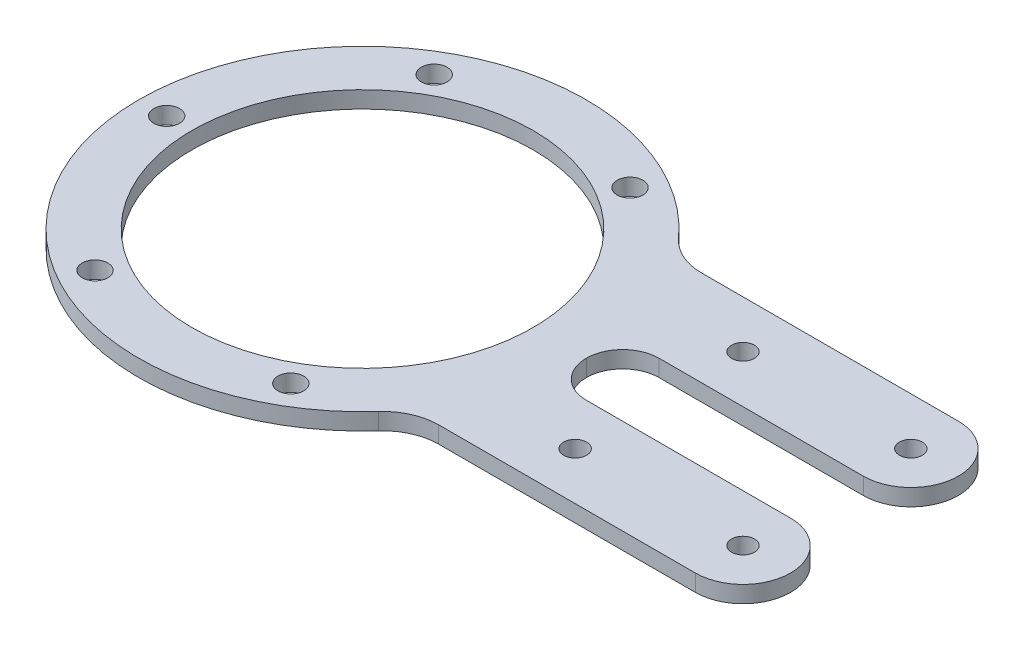
from build123d import *

# Parameters (mm, degrees)
SKETCH1_R           = 40
SKETCH1_R_2         = 30.5
BOSS_EXTRUDE1_DEPTH = 3
BOSS_EXTRUDE2_START = -3
BOSS_EXTRUDE2_DEPTH = 3
SKETCH3_R           = 2.05
CUT_EXTRUDE1_DEPTH  = 108.745069493
SKETCH4_R           = 2.3
CUT_EXTRUDE2_DEPTH  = 108.745069493
CUT_EXTRUDE3_DEPTH  = 108.745069493
FILLET1_R           = 10
FILLET2_R           = 6.5


with BuildPart() as part:
    # Sketch1 → Boss-Extrude1 (new body)
    with BuildSketch(Plane(origin=(0, 0, 0), x_dir=(1, 0, 0), z_dir=(0, 1, 0))):
        with Locations(Location((0, 0, 0), (0, 0, 270))):
            Circle(SKETCH1_R)
        with Locations(Location((0, 0, 0), (0, 0, 270))):
            Circle(SKETCH1_R_2, mode=Mode.SUBTRACT)
    extrude(amount=BOSS_EXTRUDE1_DEPTH)

    # Sketch2 → Boss-Extrude2 (add)
    with BuildSketch(Plane(origin=(0, 3, 0), x_dir=(1, 0, 0), z_dir=(0, 1, 0)).offset(BOSS_EXTRUDE2_START)):
        with BuildLine():
            Line((100, 6.5), (39.468341744, 6.5))
            ThreePointArc((39.468341744, 6.5), (36.910699238, 15.414288235), (32.368966619, 23.5))
            Line((32.368966619, 23.5), (100, 23.5))
            Line((100, 23.5), (100, 6.5))
        make_face()
        with BuildLine():
            Line((39.468341744, -6.5), (100, -6.5))
            Line((100, -6.5), (100, -23.5))
            Line((100, -23.5), (32.368966619, -23.5))
            ThreePointArc((32.368966619, -23.5), (36.910699238, -15.414288235), (39.468341744, -6.5))
        make_face()
    extrude(amount=BOSS_EXTRUDE2_DEPTH)

    # Sketch3 → Cut-Extrude1 (cut, through all)
    with BuildSketch(Plane(origin=(0, 3, 0), x_dir=(1, 0, 0), z_dir=(0, 1, 0))):
        with Locations(Location((53, 15, 0), (0, 0, 270))):
            Circle(SKETCH3_R)
        with Locations(Location((83, 15, 0), (0, 0, 270))):
            Circle(SKETCH3_R)
        with Locations(Location((53, -15, 0), (0, 0, 270))):
            Circle(SKETCH3_R)
        with Locations(Location((83, -15, 0), (0, 0, 270))):
            Circle(SKETCH3_R)
    extrude(amount=-CUT_EXTRUDE1_DEPTH, mode=Mode.SUBTRACT)

    # Sketch4 → Cut-Extrude2 (cut, through all)
    with BuildSketch(Plane(origin=(0, 3, 0), x_dir=(1, 0, 0), z_dir=(0, 1, 0))):
        with Locations(Location((-17.5, 30.310889132, 0), (0, 0, 270))):
            Circle(SKETCH4_R)
        with Locations(Location((17.5, 30.310889132, 0), (0, 0, 270))):
            Circle(SKETCH4_R)
        with Locations(Location((17.5, -30.310889132, 0), (0, 0, 270))):
            Circle(SKETCH4_R)
        with Locations(Location((-17.5, -30.310889132, 0), (0, 0, 270))):
            Circle(SKETCH4_R)
        with Locations(Location((-35, 0, 0), (0, 0, 270))):
            Circle(SKETCH4_R)
    extrude(amount=-CUT_EXTRUDE2_DEPTH, mode=Mode.SUBTRACT)

    # Sketch6 → Cut-Extrude3 (cut, through all)
    with BuildSketch(Plane(origin=(0, 3, 0), x_dir=(1, 0, 0), z_dir=(0, 1, 0))):
        with BuildLine():
            Line((100, 23.5), (83, 23.5))
            ThreePointArc((83, 23.5), (91.5, 15), (83, 6.5))
            Line((83, 6.5), (100, 6.5))
            Line((100, 6.5), (100, 23.5))
        make_face()
        with BuildLine():
            Line((100, -6.5), (83, -6.5))
            ThreePointArc((83, -6.5), (91.5, -15), (83, -23.5))
            Line((83, -23.5), (100, -23.5))
            Line((100, -23.5), (100, -6.5))
        make_face()
    extrude(amount=-CUT_EXTRUDE3_DEPTH, mode=Mode.SUBTRACT)

    # Fillet1
    fillet1_edges = [part.edges().sort_by_distance(p)[0] for p in [
        (32.368966619, 1.5, -23.5),
        (32.368966619, 1.5, 23.5),
    ]]
    fillet(fillet1_edges, radius=FILLET1_R)

    # Fillet2
    fillet2_edges = [part.edges().sort_by_distance(p)[0] for p in [
        (39.468341744, 1.5, 6.5),
        (39.468341744, 1.5, -6.5),
    ]]
    fillet(fillet2_edges, radius=FILLET2_R - 0.0001)  # a hair under: the kernel refuses the full size


solid = part.part
